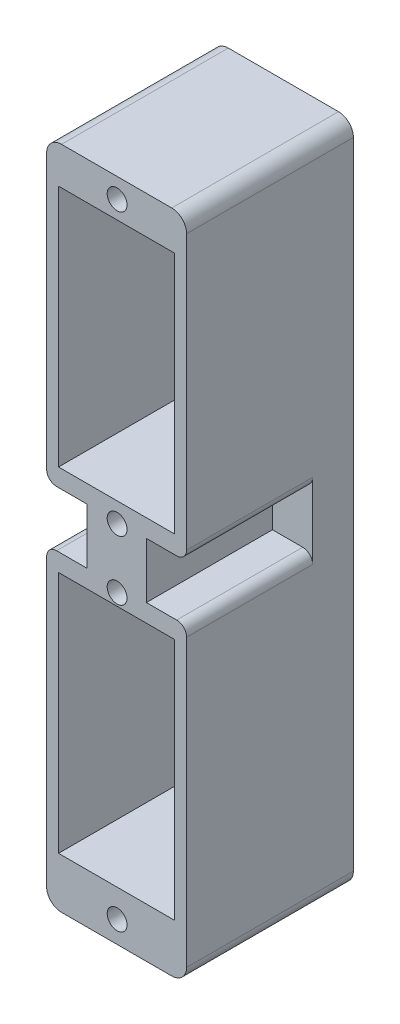
from build123d import *

# Parameters (mm, degrees)
SKETCH4_W           = 14.1
SKETCH4_H           = 67
BOSS_EXTRUDE1_DEPTH = 16.8
FILLET1_R           = 1.5
SKETCH5_W           = 11.7
SKETCH5_H           = 24.5
CUT_EXTRUDE1_DEPTH  = 16
SKETCH6_W           = 4.05
SKETCH6_H           = 5.6
CUT_EXTRUDE2_DEPTH  = 12.7
FILLET2_R           = 1
SKETCH7_R           = 1
CUT_EXTRUDE3_DEPTH  = 336.032219687


with BuildPart() as part:
    # Sketch4 → Boss-Extrude1 (new body)
    with BuildSketch(Plane.XY.offset(30)):
        with Locations((-182.786990356, 242.047210693)):
            Rectangle(SKETCH4_W, SKETCH4_H)
    extrude(amount=BOSS_EXTRUDE1_DEPTH)

    # Fillet1
    fillet1_edges = [part.edges().sort_by_distance(p)[0] for p in [
        (-189.836990356, 275.547210693, 38.4),
        (-175.736990356, 275.547210693, 38.4),
        (-189.836990356, 208.547210693, 38.4),
        (-175.736990356, 208.547210693, 38.4),
    ]]
    fillet(fillet1_edges, radius=FILLET1_R)

    # Sketch5 → Cut-Extrude1 (cut)
    with BuildSketch(Plane.XY.offset(46.8)):
        with Locations((-182.786990356, 259.497210693)):
            Rectangle(SKETCH5_W, SKETCH5_H)
        with Locations((-182.786990356, 225.797210693)):
            Rectangle(SKETCH5_W, SKETCH5_H)
    extrude(amount=-CUT_EXTRUDE1_DEPTH, mode=Mode.SUBTRACT)

    # Sketch6 → Cut-Extrude2 (cut)
    with BuildSketch(Plane.XY.offset(46.8)):
        with Locations((-187.811990356, 242.647210693)):
            Rectangle(SKETCH6_W, SKETCH6_H)
        with Locations((-177.761990356, 242.647210693)):
            Rectangle(SKETCH6_W, SKETCH6_H)
    extrude(amount=-CUT_EXTRUDE2_DEPTH, mode=Mode.SUBTRACT)

    # Fillet2
    fillet2_edges = [part.edges().sort_by_distance(p)[0] for p in [
        (-175.736990356, 239.847210693, 40.45),
        (-175.736990356, 245.447210693, 40.45),
        (-189.836990356, 239.847210693, 40.45),
        (-189.836990356, 245.447210693, 40.45),
    ]]
    fillet(fillet2_edges, radius=FILLET2_R)

    # Sketch7 → Cut-Extrude3 (cut, through all)
    with BuildSketch(Plane.XY.offset(46.8)):
        with Locations((-182.736990356, 273.547210693)):
            Circle(SKETCH7_R)
        with Locations((-182.736990356, 210.747210693)):
            Circle(SKETCH7_R)
        with Locations((-182.736990356, 245.247210693)):
            Circle(SKETCH7_R)
        with Locations((-182.736990356, 239.247210693)):
            Circle(SKETCH7_R)
    extrude(amount=-CUT_EXTRUDE3_DEPTH, mode=Mode.SUBTRACT)


solid = part.part
